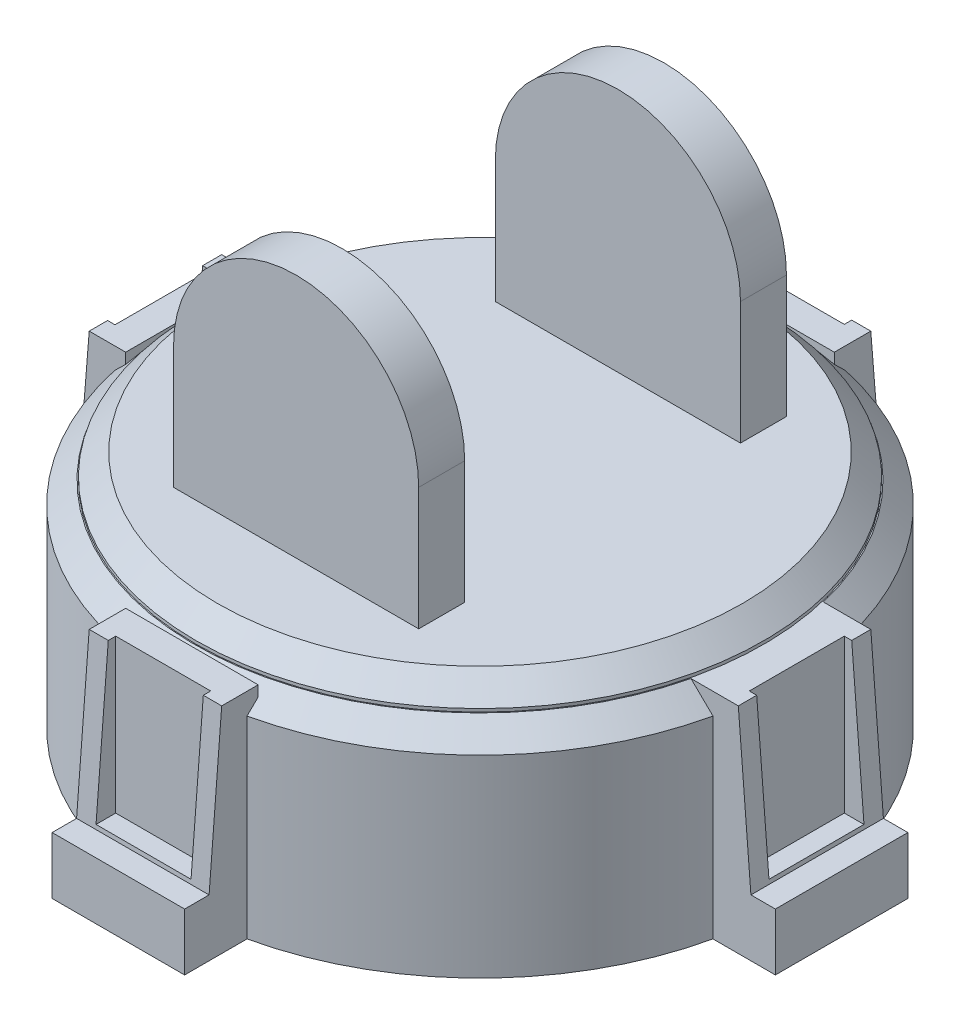
from build123d import *

# Parameters (mm, degrees)
SKETCH1_R                    = 50
BOSS_EXTRUDE1_DEPTH          = 35
SKETCH2_R                    = 46.336867636
BOSS_EXTRUDE2_DEPTH          = 4
CHAMFER5_SIZE                = 3.5
SKETCH3_W                    = 12
SKETCH3_H                    = 21.61580307
BOSS_EXTRUDE3_DEPTH          = 35
SKETCH4_W                    = 7.255124553
SKETCH4_H                    = 15.5
CUT_EXTRUDE1_DEPTH           = 25
CUT_EXTRUDE2_DEPTH           = 23
CHAMFER6_SIZE                = 3.5
CIRPATTERN2_COPY_1_SKETCH_W  = 12
CIRPATTERN2_COPY_1_SKETCH_H  = 21.61580307
CIRPATTERN2_COPY_1_DEPTH     = 35
CIRPATTERN2_COPY_2_SKETCH_W  = 12
CIRPATTERN2_COPY_2_SKETCH_H  = 21.61580307
CIRPATTERN2_COPY_2_DEPTH     = 35
CIRPATTERN2_COPY_3_SKETCH_W  = 12
CIRPATTERN2_COPY_3_SKETCH_H  = 21.61580307
CIRPATTERN2_COPY_3_DEPTH     = 35
CIRPATTERN2_COPY_4_SKETCH_W  = 7.255124553
CIRPATTERN2_COPY_4_SKETCH_H  = 15.5
CIRPATTERN2_COPY_4_DEPTH     = 25
CIRPATTERN2_COPY_5_SKETCH_W  = 7.255124553
CIRPATTERN2_COPY_5_SKETCH_H  = 15.5
CIRPATTERN2_COPY_5_DEPTH     = 25
CIRPATTERN2_COPY_6_SKETCH_W  = 7.255124553
CIRPATTERN2_COPY_6_SKETCH_H  = 15.5
CIRPATTERN2_COPY_6_DEPTH     = 25
CIRPATTERN2_COPY_7_DEPTH     = 23
CIRPATTERN2_COPY_8_DEPTH     = 23
CIRPATTERN2_COPY_9_DEPTH     = 23
CIRPATTERN2_COPY_10_SKETCH_W = 12
CIRPATTERN2_COPY_10_SKETCH_H = 21.61580307
CIRPATTERN2_COPY_10_DEPTH    = 35
CIRPATTERN2_COPY_11_SKETCH_W = 12
CIRPATTERN2_COPY_11_SKETCH_H = 21.61580307
CIRPATTERN2_COPY_11_DEPTH    = 35
CIRPATTERN2_COPY_12_SKETCH_W = 12
CIRPATTERN2_COPY_12_SKETCH_H = 21.61580307
CIRPATTERN2_COPY_12_DEPTH    = 35
CIRPATTERN2_COPY_13_SKETCH_W = 7.255124553
CIRPATTERN2_COPY_13_SKETCH_H = 15.5
CIRPATTERN2_COPY_13_DEPTH    = 25
CIRPATTERN2_COPY_14_SKETCH_W = 7.255124553
CIRPATTERN2_COPY_14_SKETCH_H = 15.5
CIRPATTERN2_COPY_14_DEPTH    = 25
CIRPATTERN2_COPY_15_SKETCH_W = 7.255124553
CIRPATTERN2_COPY_15_SKETCH_H = 15.5
CIRPATTERN2_COPY_15_DEPTH    = 25
CIRPATTERN2_COPY_16_DEPTH    = 23
CIRPATTERN2_COPY_17_DEPTH    = 23
CIRPATTERN2_COPY_18_DEPTH    = 23
SKETCH9_W                    = 40
SKETCH9_H                    = 20
BOSS_EXTRUDE5_DEPTH          = 30
SKETCH10_R                   = 20
BOSS_EXTRUDE6_DEPTH          = 30
SKETCH12_W                   = 40
SKETCH12_H                   = 45
CUT_EXTRUDE4_DEPTH           = 86


with BuildPart() as part:
    # Sketch1 → Boss-Extrude1 (new body)
    with BuildSketch(Plane(origin=(0, 0, 0), x_dir=(1, 0, 0), z_dir=(0, 1, 0))):
        Circle(SKETCH1_R)
    extrude(amount=BOSS_EXTRUDE1_DEPTH)

    # Sketch2 → Boss-Extrude2 (add)
    with BuildSketch(Plane(origin=(0, 35, 0), x_dir=(1, 0, 0), z_dir=(0, 1, 0))):
        Circle(SKETCH2_R)
    extrude(amount=BOSS_EXTRUDE2_DEPTH)

    # Chamfer5
    chamfer5_edges = [part.edges().sort_by_distance(p)[0] for p in [
        (-46.336867636, 39, 0),
    ]]
    chamfer(chamfer5_edges, length=CHAMFER5_SIZE)

    # Sketch3 → Boss-Extrude3 (add)
    with BuildSketch(Plane(origin=(0, 35, 0), x_dir=(1, 0, 0), z_dir=(0, 1, 0))):
        with Locations((53, 0)):
            Rectangle(SKETCH3_W, SKETCH3_H)
    boss_extrude3 = extrude(amount=-BOSS_EXTRUDE3_DEPTH)

    # Sketch4 → Cut-Extrude1 (cut)
    with BuildSketch(Plane(origin=(0, 35, 0), x_dir=(1, 0, 0), z_dir=(0, 1, 0))):
        with Locations((55.372437724, 0.057901535)):
            Rectangle(SKETCH4_W, SKETCH4_H)
    cut_extrude1 = extrude(amount=-CUT_EXTRUDE1_DEPTH, mode=Mode.SUBTRACT)

    # Sketch7 → Cut-Extrude2 (cut)
    with BuildSketch(Plane.XY.offset(10.807901535)):
        Polygon((52.952051595, 35), (55.010115538, 9.319609638), (59, 9.319609638), (59, 35), align=None)
    cut_extrude2 = extrude(amount=-CUT_EXTRUDE2_DEPTH, mode=Mode.SUBTRACT)

    # Chamfer6
    chamfer6_edges = [part.edges().sort_by_distance(p)[0] for p in [
        (-50, 35, 0),
    ]]
    chamfer(chamfer6_edges, length=CHAMFER6_SIZE)

    # Mirror1: Boss-Extrude3, Cut-Extrude1, Cut-Extrude2 across plane
    add(boss_extrude3.mirror(Plane(origin=(0, 0, 0), x_dir=(0, 0, 1), z_dir=(1, 0, 0))))
    add(cut_extrude1.mirror(Plane(origin=(0, 0, 0), x_dir=(0, 0, 1), z_dir=(1, 0, 0))), mode=Mode.SUBTRACT)
    add(cut_extrude2.mirror(Plane(origin=(0, 0, 0), x_dir=(0, 0, 1), z_dir=(1, 0, 0))), mode=Mode.SUBTRACT)

    # CirPattern2 copy 1 sketch → CirPattern2 copy 1 (add)
    with BuildSketch(Plane(origin=(0, 35, 0), x_dir=(0, 0, -1), z_dir=(0, 1, 0))):
        with Locations((53, 0)):
            Rectangle(CIRPATTERN2_COPY_1_SKETCH_W, CIRPATTERN2_COPY_1_SKETCH_H)
    extrude(amount=-CIRPATTERN2_COPY_1_DEPTH)

    # CirPattern2 copy 2 sketch → CirPattern2 copy 2 (add)
    with BuildSketch(Plane(origin=(0, 35, 0), x_dir=(1, 0, 0), z_dir=(0, 1, 0))):
        with Locations((53, 0)):
            Rectangle(CIRPATTERN2_COPY_2_SKETCH_W, CIRPATTERN2_COPY_2_SKETCH_H)
    extrude(amount=-CIRPATTERN2_COPY_2_DEPTH)

    # CirPattern2 copy 3 sketch → CirPattern2 copy 3 (add)
    with BuildSketch(Plane.ZX.offset(35)):
        with Locations((53, 0)):
            Rectangle(CIRPATTERN2_COPY_3_SKETCH_W, CIRPATTERN2_COPY_3_SKETCH_H)
    extrude(amount=-CIRPATTERN2_COPY_3_DEPTH)

    # CirPattern2 copy 4 sketch → CirPattern2 copy 4 (cut)
    with BuildSketch(Plane(origin=(0, 35, 0), x_dir=(0, 0, -1), z_dir=(0, 1, 0))):
        with Locations((55.372437724, -0.057901535)):
            Rectangle(CIRPATTERN2_COPY_4_SKETCH_W, CIRPATTERN2_COPY_4_SKETCH_H)
    extrude(amount=-CIRPATTERN2_COPY_4_DEPTH, mode=Mode.SUBTRACT)

    # CirPattern2 copy 5 sketch → CirPattern2 copy 5 (cut)
    with BuildSketch(Plane(origin=(0, 35, 0), x_dir=(1, 0, 0), z_dir=(0, 1, 0))):
        with Locations((55.372437724, -0.057901535)):
            Rectangle(CIRPATTERN2_COPY_5_SKETCH_W, CIRPATTERN2_COPY_5_SKETCH_H)
    extrude(amount=-CIRPATTERN2_COPY_5_DEPTH, mode=Mode.SUBTRACT)

    # CirPattern2 copy 6 sketch → CirPattern2 copy 6 (cut)
    with BuildSketch(Plane.ZX.offset(35)):
        with Locations((55.372437724, -0.057901535)):
            Rectangle(CIRPATTERN2_COPY_6_SKETCH_W, CIRPATTERN2_COPY_6_SKETCH_H)
    extrude(amount=-CIRPATTERN2_COPY_6_DEPTH, mode=Mode.SUBTRACT)

    # CirPattern2 copy 7 sketch → CirPattern2 copy 7 (cut)
    with BuildSketch(Plane(origin=(-10.807901535, 0, 0), x_dir=(0, 0, -1), z_dir=(-1, 0, 0))):
        Polygon((52.952051595, -35), (55.010115538, -9.319609638), (59, -9.319609638), (59, -35), align=None)
    extrude(amount=-CIRPATTERN2_COPY_7_DEPTH, mode=Mode.SUBTRACT)

    # CirPattern2 copy 8 sketch → CirPattern2 copy 8 (cut)
    with BuildSketch(Plane(origin=(0, 0, -10.807901535), x_dir=(1, 0, 0), z_dir=(0, 0, -1))):
        Polygon((52.952051595, -35), (55.010115538, -9.319609638), (59, -9.319609638), (59, -35), align=None)
    extrude(amount=-CIRPATTERN2_COPY_8_DEPTH, mode=Mode.SUBTRACT)

    # CirPattern2 copy 9 sketch → CirPattern2 copy 9 (cut)
    with BuildSketch(Plane(origin=(10.807901535, 0, 0), x_dir=(0, 0, 1), z_dir=(1, 0, 0))):
        Polygon((52.952051595, -35), (55.010115538, -9.319609638), (59, -9.319609638), (59, -35), align=None)
    extrude(amount=-CIRPATTERN2_COPY_9_DEPTH, mode=Mode.SUBTRACT)

    # CirPattern2 copy 10 sketch → CirPattern2 copy 10 (add)
    with BuildSketch(Plane.ZX.offset(35)):
        with Locations((53, 0)):
            Rectangle(CIRPATTERN2_COPY_10_SKETCH_W, CIRPATTERN2_COPY_10_SKETCH_H)
    extrude(amount=-CIRPATTERN2_COPY_10_DEPTH)

    # CirPattern2 copy 11 sketch → CirPattern2 copy 11 (add)
    with BuildSketch(Plane(origin=(0, 35, 0), x_dir=(-1, 0, 0), z_dir=(0, 1, 0))):
        with Locations((53, 0)):
            Rectangle(CIRPATTERN2_COPY_11_SKETCH_W, CIRPATTERN2_COPY_11_SKETCH_H)
    extrude(amount=-CIRPATTERN2_COPY_11_DEPTH)

    # CirPattern2 copy 12 sketch → CirPattern2 copy 12 (add)
    with BuildSketch(Plane(origin=(0, 35, 0), x_dir=(0, 0, -1), z_dir=(0, 1, 0))):
        with Locations((53, 0)):
            Rectangle(CIRPATTERN2_COPY_12_SKETCH_W, CIRPATTERN2_COPY_12_SKETCH_H)
    extrude(amount=-CIRPATTERN2_COPY_12_DEPTH)

    # CirPattern2 copy 13 sketch → CirPattern2 copy 13 (cut)
    with BuildSketch(Plane.ZX.offset(35)):
        with Locations((55.372437724, 0.057901535)):
            Rectangle(CIRPATTERN2_COPY_13_SKETCH_W, CIRPATTERN2_COPY_13_SKETCH_H)
    extrude(amount=-CIRPATTERN2_COPY_13_DEPTH, mode=Mode.SUBTRACT)

    # CirPattern2 copy 14 sketch → CirPattern2 copy 14 (cut)
    with BuildSketch(Plane(origin=(0, 35, 0), x_dir=(-1, 0, 0), z_dir=(0, 1, 0))):
        with Locations((55.372437724, 0.057901535)):
            Rectangle(CIRPATTERN2_COPY_14_SKETCH_W, CIRPATTERN2_COPY_14_SKETCH_H)
    extrude(amount=-CIRPATTERN2_COPY_14_DEPTH, mode=Mode.SUBTRACT)

    # CirPattern2 copy 15 sketch → CirPattern2 copy 15 (cut)
    with BuildSketch(Plane(origin=(0, 35, 0), x_dir=(0, 0, -1), z_dir=(0, 1, 0))):
        with Locations((55.372437724, 0.057901535)):
            Rectangle(CIRPATTERN2_COPY_15_SKETCH_W, CIRPATTERN2_COPY_15_SKETCH_H)
    extrude(amount=-CIRPATTERN2_COPY_15_DEPTH, mode=Mode.SUBTRACT)

    # CirPattern2 copy 16 sketch → CirPattern2 copy 16 (cut)
    with BuildSketch(Plane.ZY.offset(10.807901535)):
        Polygon((52.952051595, 35), (55.010115538, 9.319609638), (59, 9.319609638), (59, 35), align=None)
    extrude(amount=-CIRPATTERN2_COPY_16_DEPTH, mode=Mode.SUBTRACT)

    # CirPattern2 copy 17 sketch → CirPattern2 copy 17 (cut)
    with BuildSketch(Plane(origin=(0, 0, -10.807901535), x_dir=(-1, 0, 0), z_dir=(0, 0, -1))):
        Polygon((52.952051595, 35), (55.010115538, 9.319609638), (59, 9.319609638), (59, 35), align=None)
    extrude(amount=-CIRPATTERN2_COPY_17_DEPTH, mode=Mode.SUBTRACT)

    # CirPattern2 copy 18 sketch → CirPattern2 copy 18 (cut)
    with BuildSketch(Plane(origin=(10.807901535, 0, 0), x_dir=(0, 0, -1), z_dir=(1, 0, 0))):
        Polygon((52.952051595, 35), (55.010115538, 9.319609638), (59, 9.319609638), (59, 35), align=None)
    extrude(amount=-CIRPATTERN2_COPY_18_DEPTH, mode=Mode.SUBTRACT)

    # Sketch9 → Boss-Extrude5 (add)
    with BuildSketch(Plane.XY):
        with Locations((0, 49)):
            Rectangle(SKETCH9_W, SKETCH9_H)
    boss_extrude5 = extrude(amount=BOSS_EXTRUDE5_DEPTH)

    # Sketch10 → Boss-Extrude6 (add)
    with BuildSketch(Plane.XY.offset(30)):
        with Locations((0, 59)):
            Circle(SKETCH10_R)
    boss_extrude6 = extrude(amount=-BOSS_EXTRUDE6_DEPTH)

    # Sketch12 → Cut-Extrude4 (cut)
    with BuildSketch(Plane(origin=(0, 39, 0), x_dir=(1, 0, 0), z_dir=(0, 1, 0))):
        Rectangle(SKETCH12_W, SKETCH12_H)
    cut_extrude4 = extrude(amount=CUT_EXTRUDE4_DEPTH, mode=Mode.SUBTRACT)

    # Mirror4: Boss-Extrude5, Boss-Extrude6, Cut-Extrude4 across plane
    add(boss_extrude5.mirror(Plane.XY))
    add(boss_extrude6.mirror(Plane.XY))
    add(cut_extrude4.mirror(Plane.XY), mode=Mode.SUBTRACT)


solid = part.part
